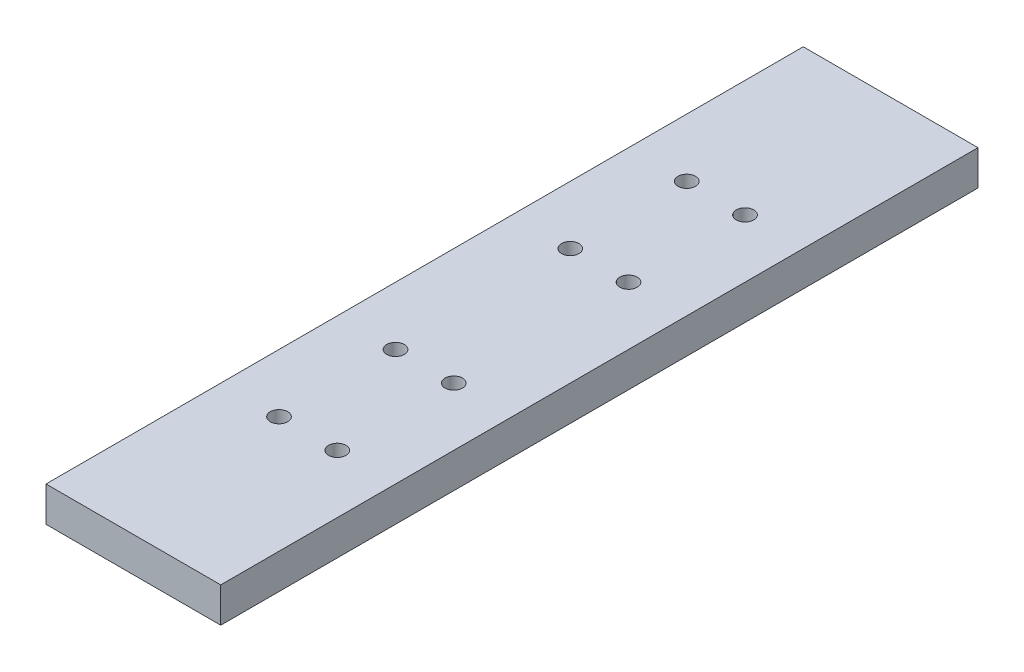
from build123d import *

# Parameters (mm, degrees)
SKETCH2_W           = 30
SKETCH2_H           = 6
BOSS_EXTRUDE1_DEPTH = 130
SKETCH3_R           = 1.5
CUT_EXTRUDE3_DEPTH  = 132


with BuildPart() as part:
    # Sketch2 → Boss-Extrude1 (new body)
    with BuildSketch(Plane.XY):
        Rectangle(SKETCH2_W, SKETCH2_H)
    extrude(amount=BOSS_EXTRUDE1_DEPTH)

    # Sketch3 → Cut-Extrude3 (cut, through all)
    with BuildSketch(Plane(origin=(0, 3, 0), x_dir=(1, 0, 0), z_dir=(0, 1, 0))):
        with Locations((-5, -100)):
            Circle(SKETCH3_R)
        with Locations((5, -100)):
            Circle(SKETCH3_R)
        with Locations((5, -80)):
            Circle(SKETCH3_R)
        with Locations((-5, -80)):
            Circle(SKETCH3_R)
        with Locations((-5, -50)):
            Circle(SKETCH3_R)
        with Locations((5, -50)):
            Circle(SKETCH3_R)
        with Locations((5, -30)):
            Circle(SKETCH3_R)
        with Locations((-5, -30)):
            Circle(SKETCH3_R)
    extrude(amount=-CUT_EXTRUDE3_DEPTH, mode=Mode.SUBTRACT)


solid = part.part
